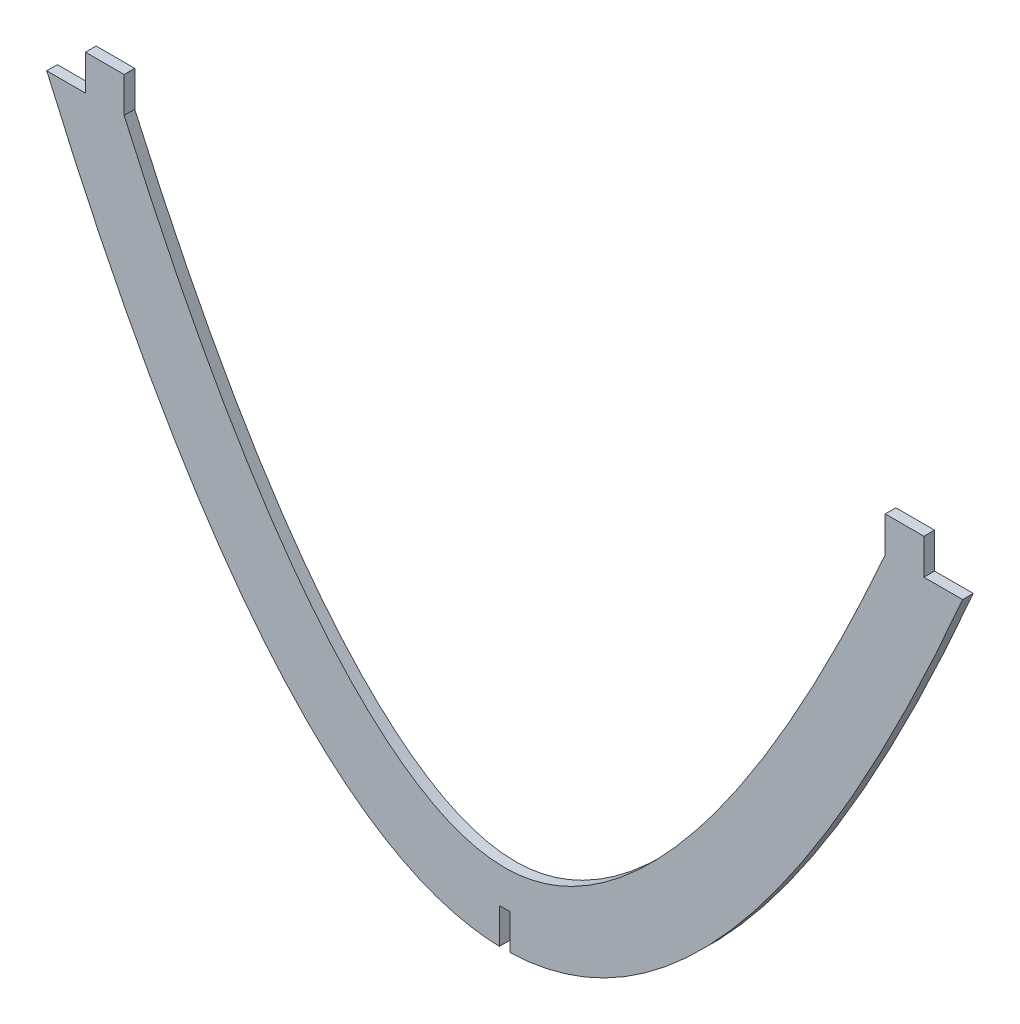
from build123d import *

# Parameters (mm, degrees)
BOSS_EXTRUDE1_DEPTH = 3
SKETCH4_W           = 2.999863356
SKETCH4_H           = 9.998922379
CUT_EXTRUDE1_DEPTH  = 59


# Read off the part's stored shape, not the designer's step: Boss-Extrude1
with BuildPart() as part:
    # Boss-Extrude1 outline → Boss-Extrude1 (new body)
    with BuildSketch(Plane.XY):
        with BuildLine():
            Line((-118.189248577, 160.000000006), (-118.189248577, 150.000000006))
            Line((-118.189248577, 150.000000006), (-129.099444876, 150.000000006))
            add(Edge.make_bspline(
                [(-129.099444876, 150.000000006), (-3e-09, -149.999999999), (129.099444871, 149.999999993)],
                knots=[0.05395051, 0.05395051, 0.05395051, 0.94604949, 0.94604949, 0.94604949], degree=2))
            Line((129.099444871, 149.999999993), (118.189248572, 149.999999993))
            Line((118.189248572, 149.999999993), (118.189248572, 159.999999993))
            Line((118.189248572, 159.999999993), (107.279052273, 159.999999993))
            Line((107.279052273, 159.999999993), (107.279052273, 149.999999993))
            add(Edge.make_bspline(
                [(-107.279052278, 150.000000004), (-97.183104825, 127.186517466), (-79.444733684, 93.708440604), (-64.161675128, 69.308365489), (-49.305393546, 49.915770109), (-35.13866486, 35.555231256), (-22.048355535, 26.113129248), (-11.855422137, 21.724421759), (-5.17246227, 20.278244385), (-2e-09, 19.904378215), (5.172462266, 20.278244384), (11.855422133, 21.724421758), (22.048355531, 26.113129246), (35.138664855, 35.555231252), (49.305393541, 49.915770103), (64.161675123, 69.308365482), (79.444733679, 93.708440595), (97.18310482, 127.186517456), (107.279052273, 149.999999993)],
                knots=[0.066145022, 0.066145022, 0.066145022, 0.13758479, 0.193340976, 0.249097162, 0.304853348, 0.360609534, 0.416365721, 0.45818286, 0.486060953, 0.513939047, 0.54181714, 0.583634279, 0.639390465, 0.695146652, 0.750902838, 0.806659024, 0.86241521, 0.933854978, 0.933854978, 0.933854978], degree=2))
            Line((-107.279052278, 150.000000004), (-107.279052278, 160.000000006))
            Line((-107.279052278, 160.000000006), (-118.189248577, 160.000000006))
        make_face()
    extrude(amount=BOSS_EXTRUDE1_DEPTH)

    # Sketch4 → Cut-Extrude1 (cut)
    with BuildSketch(Plane.XY):
        with Locations((6.8322e-05, 4.99946119)):
            Rectangle(SKETCH4_W, SKETCH4_H)
    extrude(amount=CUT_EXTRUDE1_DEPTH, mode=Mode.SUBTRACT)


solid = part.part
